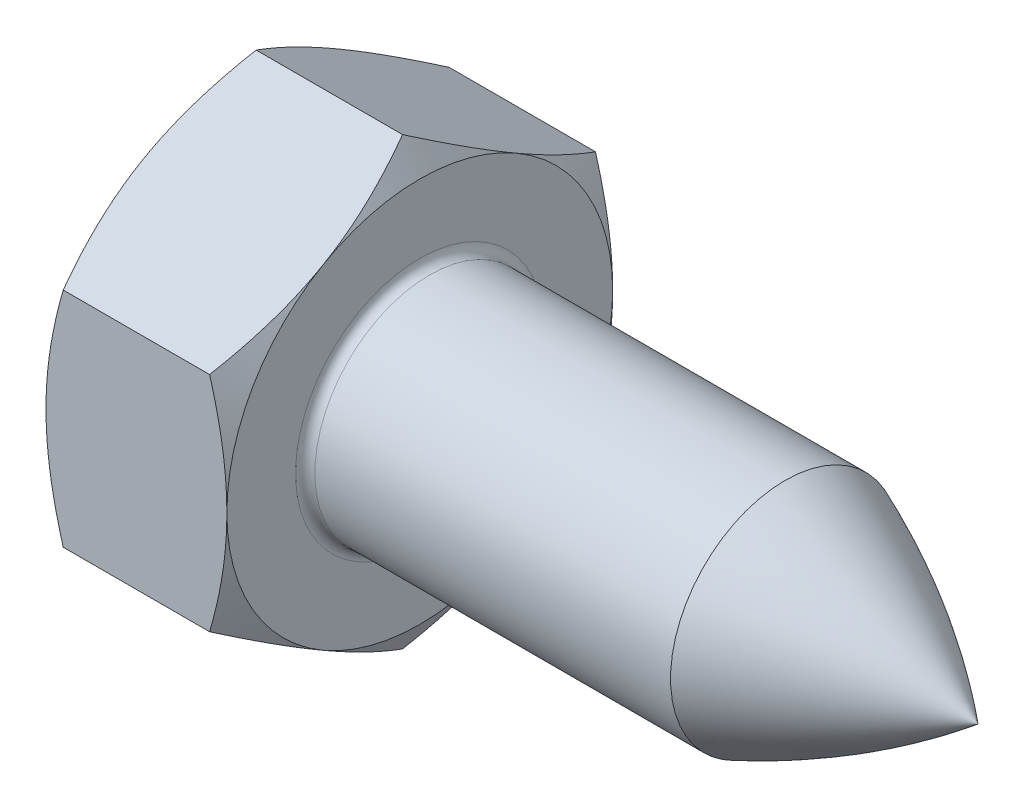
from build123d import *

# Parameters (mm, degrees)
BASEHEAD_DEPTH = 7.5
SKETCH1_W      = 23.15
SKETCH1_H      = 4.75
SKETCH7_W      = 1.6
SKETCH7_H      = 6.666666667
FILLET1_R      = 0.4


with BuildPart() as part:
    # Sketch2 → BaseHead (new body)
    with BuildSketch(Plane(origin=(0, 0, 0), x_dir=(0, 0, -1), z_dir=(1, 0, 0))):
        Polygon((0, 9.237604307), (-8, 4.618802154), (-8, -4.618802154), (0, -9.237604307), (8, -4.618802154), (8, 4.618802154), align=None)
    extrude(amount=BASEHEAD_DEPTH)

    # Sketch1 → BaseBody (revolve)
    with BuildSketch(Plane.XY):
        with Locations((19.075, 2.375)):
            Rectangle(SKETCH1_W, SKETCH1_H)
    revolve(axis=Axis((-9.544470106, 0, 0), (1, 0, 0)))

    # Sketch3 → Cut-Revolve7 (revolve, cut)
    with BuildSketch(Plane.XY):
        Polygon((0, 8), (0.71453118, 9.237604307), (0, 9.237604307), align=None)
        Polygon((7.5, 9.237604307), (7.5, 8), (6.78546882, 9.237604307), align=None)
    revolve(axis=Axis((10.663764742, 0, 0), (-1, 0, 0)), mode=Mode.SUBTRACT)

    # Sketch7 → Cut-Revolve8 (revolve, cut)
    with BuildSketch(Plane.XY):
        with Locations((0.7, 3.333333334)):
            Rectangle(SKETCH7_W, SKETCH7_H)
    revolve(axis=Axis((0, 0, 0), (-1, 0, 0)), mode=Mode.SUBTRACT)

    # Sketch4 → Cut-Loft1 section 0
    with BuildSketch(Plane(origin=(1.5, -1.114749372, 0.168839225), x_dir=(0, 0, 1), z_dir=(-1, 0, 0)), mode=Mode.PRIVATE) as cut_loft1_s0:
        with BuildLine():
            Line((0.551160775, 4.714749372), (-0.888839225, 4.714749372))
            Line((-0.888839225, 4.714749372), (-0.888839225, 1.834749372))
            Line((-0.888839225, 1.834749372), (-3.768839225, 1.834749372))
            Line((-3.768839225, 1.834749372), (-3.768839225, 0.394749372))
            Line((-3.768839225, 0.394749372), (-0.888839225, 0.394749372))
            Line((-0.888839225, 0.394749372), (-0.888839225, -2.485250628))
            Line((-0.888839225, -2.485250628), (0.551160775, -2.485250628))
            Line((0.551160775, -2.485250628), (0.551160775, 0.394749372))
            Line((0.551160775, 0.394749372), (3.431160775, 0.394749372))
            Line((3.431160775, 0.394749372), (3.431160775, 1.834749372))
            Line((3.431160775, 1.834749372), (0.551160775, 1.834749372))
            Line((0.551160775, 1.834749372), (0.551160775, 4.714749372))
        make_face()
    loft([Vertex(7.5, 0, 0), cut_loft1_s0.sketch], mode=Mode.SUBTRACT)

    # Fillet1
    fillet1_edges = [part.edges().sort_by_distance(p)[0] for p in [
        (7.5, -4.75, 0),
    ]]
    fillet(fillet1_edges, radius=FILLET1_R)

    # Sketch5 → Cut-Revolve1 (revolve, cut)
    with BuildSketch(Plane.XY):
        Polygon((26.45, -4.75), (28.55, -4.75), (30.65, -4.225), (30.65, -5.25), (26.45, -5.25), align=None)
    revolve(axis=Axis((31.978193536, 0, 0), (-1, 0, 0)), mode=Mode.SUBTRACT)

    # Sketch6 → Cut-Revolve6 (revolve, cut)
    with BuildSketch(Plane.XY):
        with BuildLine():
            Line((30.65, 0), (31.15, 0))
            Line((31.15, 0), (31.15, -4.75))
            Line((31.15, -4.75), (30.65, -4.75))
            Line((30.65, -4.75), (22.65, -4.75))
            ThreePointArc((22.65, -4.75), (26.823552739, -2.66729935), (30.65, 0))
        make_face()
    revolve(axis=Axis((33.390663239, 0, 0), (-1, 0, 0)), mode=Mode.SUBTRACT)


solid = part.part
